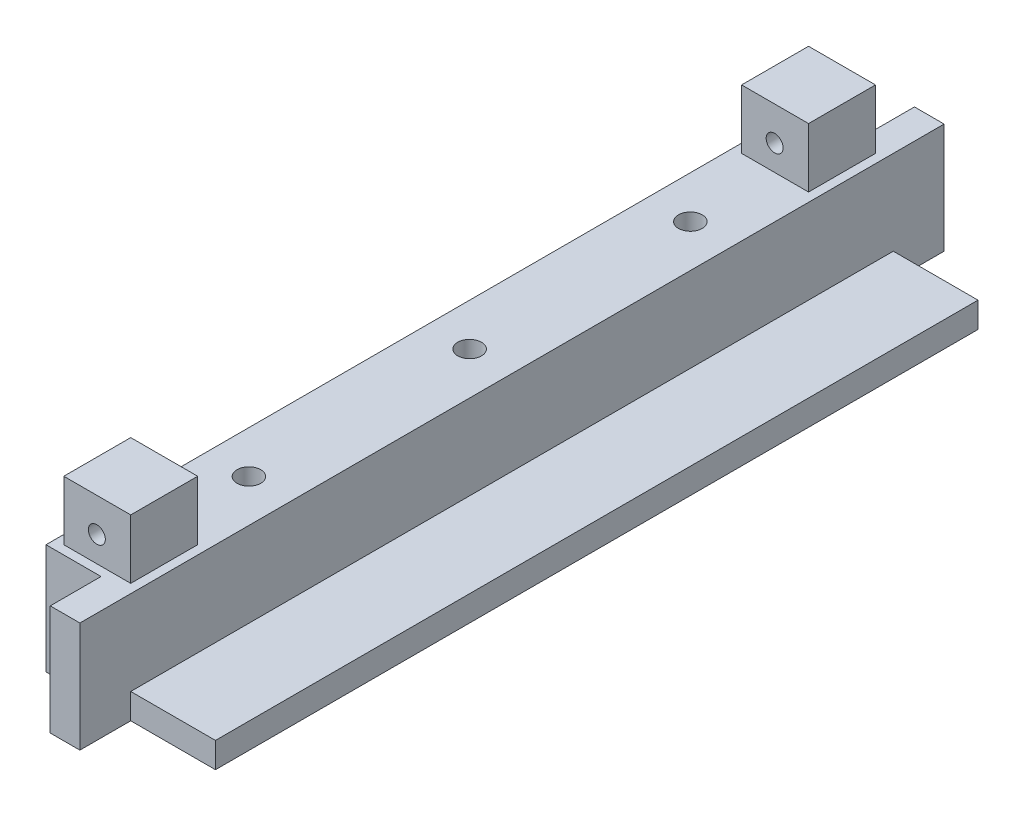
from build123d import *

# Parameters (mm, degrees)
DODANIE_WYCI_GNI_CIE1_DEPTH = 180
SZKIC2_W                    = 15.8
SZKIC2_H                    = 15.8
DODANIE_WYCI_GNI_CIE2_DEPTH = 14
SZKIC5_R                    = 2.8
WYTNIJ_WYCI_GNI_CIE2_DEPTH  = 10
SZKIC6_R                    = 2
WYTNIJ_WYCI_GNI_CIE3_DEPTH  = 183.00112637
SZKIC9_W                    = 7
SZKIC9_H                    = 26
DODANIE_WYCI_GNI_CIE4_DEPTH = 12
SZKIC10_W                   = 10.2
SZKIC10_H                   = 10.2
WYTNIJ_WYCI_GNI_CIE4_DEPTH  = 2


with BuildPart() as part:
    # Szkic1 → Dodanie-wyciągnięcie1 (new body)
    with BuildSketch(Plane.XY):
        Polygon((10, -16), (10, -10), (-10, -10), (-10, 10), (-30, 10), (-30, -16), align=None)
    extrude(amount=DODANIE_WYCI_GNI_CIE1_DEPTH)

    # Szkic2 → Dodanie-wyciągnięcie2 (add)
    with BuildSketch(Plane(origin=(0, 10, 0), x_dir=(1, 0, 0), z_dir=(0, 1, 0))):
        with Locations((-20, -10)):
            Rectangle(SZKIC2_W, SZKIC2_H)
    dodanie_wyci_gni_cie2 = extrude(amount=DODANIE_WYCI_GNI_CIE2_DEPTH)

    # Lustro1: Dodanie-wyciągnięcie2 across plane
    add(dodanie_wyci_gni_cie2.mirror(Plane.XY.offset(90)))

    # Szkic5 → Wytnij-wyciągnięcie2 (cut)
    with BuildSketch(Plane(origin=(0, 10, 0), x_dir=(1, 0, 0), z_dir=(0, 1, 0))):
        with Locations((-20, -142.1)):
            Circle(SZKIC5_R)
        with Locations((-20, -90)):
            Circle(SZKIC5_R)
        with Locations((-20, -37.9)):
            Circle(SZKIC5_R)
    extrude(amount=-WYTNIJ_WYCI_GNI_CIE2_DEPTH, mode=Mode.SUBTRACT)

    # Szkic6 → Wytnij-wyciągnięcie3 (cut, through all)
    with BuildSketch(Plane.XY.offset(177.9)):
        with Locations((-20.1, 16)):
            Circle(SZKIC6_R)
    extrude(amount=-WYTNIJ_WYCI_GNI_CIE3_DEPTH, mode=Mode.SUBTRACT)

    # Szkic9 → Dodanie-wyciągnięcie4 (add)
    with BuildSketch(Plane.XY.offset(180)):
        with Locations((-13.5, -3)):
            Rectangle(SZKIC9_W, SZKIC9_H)
    dodanie_wyci_gni_cie4 = extrude(amount=DODANIE_WYCI_GNI_CIE4_DEPTH)

    # Szkic10 → Wytnij-wyciągnięcie4 (cut)
    with BuildSketch(Plane.ZY.offset(17)):
        with Locations((186, -3)):
            Rectangle(SZKIC10_W, SZKIC10_H)
    wytnij_wyci_gni_cie4 = extrude(amount=-WYTNIJ_WYCI_GNI_CIE4_DEPTH, mode=Mode.SUBTRACT)

    # Lustro2: Dodanie-wyciągnięcie4, Wytnij-wyciągnięcie4 across plane
    add(dodanie_wyci_gni_cie4.mirror(Plane.XY.offset(90)))
    add(wytnij_wyci_gni_cie4.mirror(Plane.XY.offset(90)), mode=Mode.SUBTRACT)


solid = part.part
